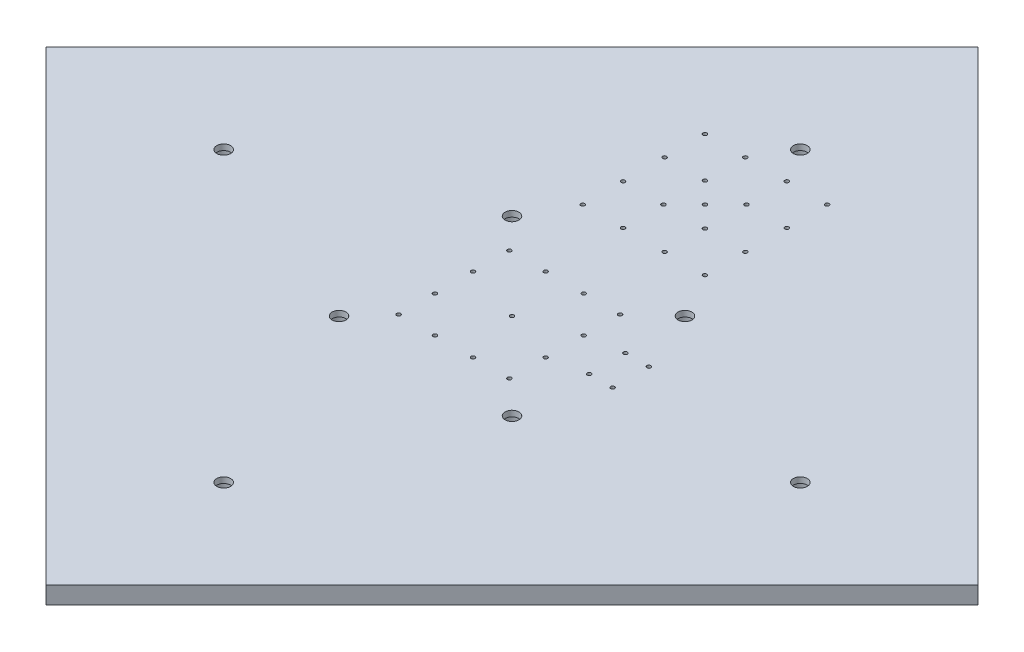
from build123d import *

# Parameters (mm, degrees)
BOSS_EXTRUDE1_DEPTH             = 15
CBORE_FOR_M10_SHCS1_D           = 12
CBORE_FOR_M10_SHCS1_CBORE_D     = 18
CBORE_FOR_M10_SHCS1_CBORE_DEPTH = 10
CBORE_FOR_M3_SHCS1_D            = 3.4
CBORE_FOR_M3_SHCS1_CBORE_D      = 6.5
CBORE_FOR_M3_SHCS1_CBORE_DEPTH  = 4
CBORE_FOR_M3_SHCS2_D            = 3.4
CBORE_FOR_M3_SHCS2_CBORE_D      = 6.5
CBORE_FOR_M3_SHCS2_CBORE_DEPTH  = 4


with BuildPart() as part:
    # Sketch1 → Boss-Extrude1 (new body)
    with BuildSketch(Plane(origin=(0, 0, 0), x_dir=(1, 0, 0), z_dir=(0, 1, 0))):
        Polygon((-404.111525448, 0), (0, 404.111525448), (404.111525448, 0), (0, -404.111525448), align=None)
    extrude(amount=BOSS_EXTRUDE1_DEPTH)

    # CBORE for M10 SHCS1 (through all)
    with Locations(Plane.XZ):
        with Locations((75, 75), (0, -250), (250, 0), (0, 250), (-250, 0), (75, -75), (-75, -75), (-75, 75)):
            CounterBoreHole(CBORE_FOR_M10_SHCS1_D / 2, CBORE_FOR_M10_SHCS1_CBORE_D / 2, CBORE_FOR_M10_SHCS1_CBORE_DEPTH)

    # CBORE for M3 SHCS1 (through all)
    with Locations(Plane(origin=(0, 0, 0), x_dir=(-1, 0, 0), z_dir=(0, -1, 0))):
        with Locations((0, 0), (-45.7, -48), (18.8, -48), (-14.2, -48), (50.3, -48), (50.3, -16.5), (50.3, 16.5), (50.3, 48), (18.8, 48), (-14.2, 48), (-45.7, 48), (-77.05, -10.1), (-97.4, -10.1), (-97.4, 21.3), (-77.05, 21.3), (-45.7, -16.5), (-45.7, 16.5)):
            CounterBoreHole(CBORE_FOR_M3_SHCS1_D / 2, CBORE_FOR_M3_SHCS1_CBORE_D / 2, CBORE_FOR_M3_SHCS1_CBORE_DEPTH)

    # CBORE for M3 SHCS2 (through all)
    with Locations(Plane(origin=(0, 0, 0), x_dir=(-1, 0, 0), z_dir=(0, -1, 0))):
        with Locations((0, 167.320913922), (53, 114.320913922), (53, 149.320913922), (53, 185.320913922), (53, 220.320913922), (18, 220.320913922), (-18, 220.320913922), (-53, 220.320913922), (-53, 185.320913922), (-53, 149.320913922), (-53, 114.320913922), (-18, 114.320913922), (18, 114.320913922), (18, 149.320913922), (18, 185.320913922), (-18, 149.320913922), (-18, 185.320913922)):
            CounterBoreHole(CBORE_FOR_M3_SHCS2_D / 2, CBORE_FOR_M3_SHCS2_CBORE_D / 2, CBORE_FOR_M3_SHCS2_CBORE_DEPTH)


solid = part.part
